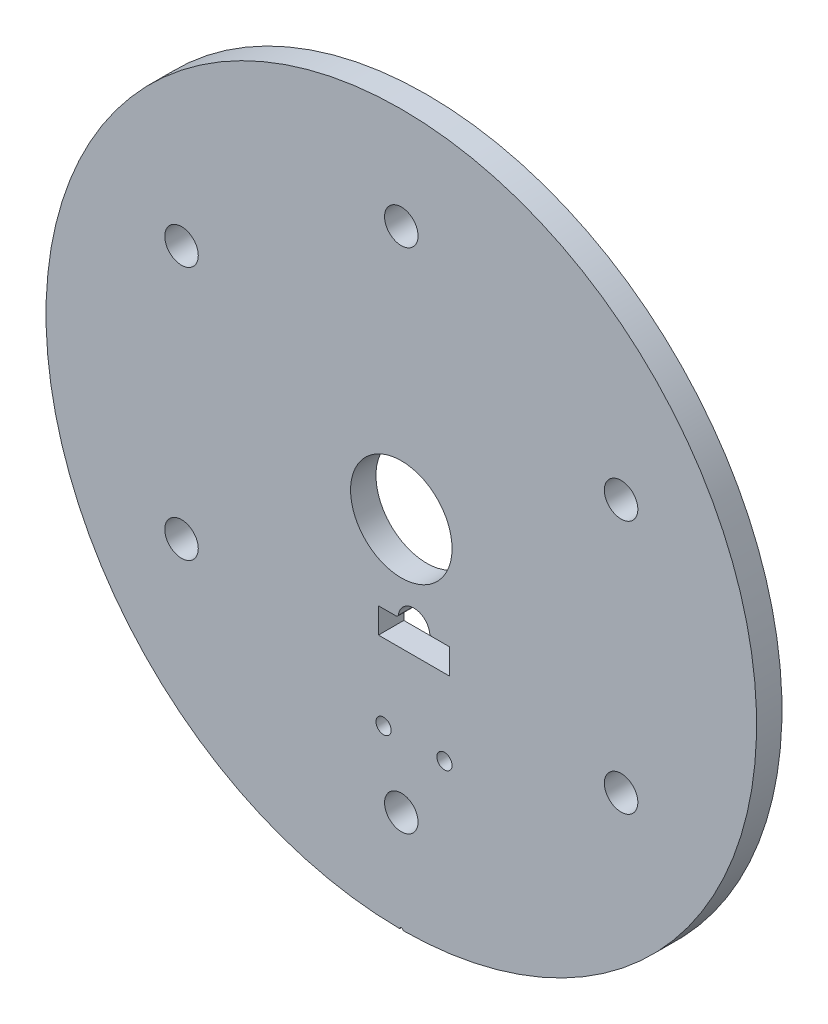
from build123d import *

# Parameters (mm, degrees)
SKETCH1_R                = 70
BOSS_EXTRUDE1_DEPTH      = 5
SKETCH4_R                = 3
CUT_EXTRUDE2_DEPTH       = 100.121138008
CIRPATTERN1_COUNT        = 6
M6_CLEARANCE_HOLE1_D     = 6.6
SKETCH7_W                = 14
SKETCH7_H                = 5
CUT_EXTRUDE3_DEPTH       = 100.121138008
SKETCH8_R                = 1
SKETCH8_R_2              = 3.1
CUT_EXTRUDE4_DEPTH       = 100.121138008
F_0000_CLEARANCE_HOLE3_D = 0.6604
FILLET1_R                = 0.5
SKETCH20_R               = 1.5
CUT_EXTRUDE6_DEPTH       = 100.121138008
SKETCH21_R               = 10
CUT_EXTRUDE9_DEPTH       = 100.121138008


with BuildPart() as part:
    # Sketch1 → Boss-Extrude1 (new body)
    with BuildSketch(Plane.XY):
        Circle(SKETCH1_R)
    extrude(amount=BOSS_EXTRUDE1_DEPTH)

    # Sketch4 → Cut-Extrude2 (cut, through all)
    with BuildSketch(Plane.XY):
        with Locations((0, 50)):
            Circle(SKETCH4_R)
    cut_extrude2 = extrude(amount=CUT_EXTRUDE2_DEPTH, mode=Mode.SUBTRACT)

    # CirPattern1: Cut-Extrude2 ×6 about axis
    cirpattern1_axis = Axis((0, 0, 46.505710968), (0, 0, -1))
    for i in range(1, CIRPATTERN1_COUNT):
        add(cut_extrude2.rotate(cirpattern1_axis, i * 360 / CIRPATTERN1_COUNT), mode=Mode.SUBTRACT)

    # M6 Clearance Hole1 (through all)
    with Locations(Plane.XY.offset(5)):
        with Locations((0, 50), (43.301270189, 25), (43.301270189, -25), (0, -50), (-43.301270189, -25), (-43.301270189, 25)):
            Hole(M6_CLEARANCE_HOLE1_D / 2)

    # Sketch7 → Cut-Extrude3 (cut, through all)
    with BuildSketch(Plane.XY):
        with Locations((2.5, -19.5)):
            Rectangle(SKETCH7_W, SKETCH7_H)
    extrude(amount=CUT_EXTRUDE3_DEPTH, mode=Mode.SUBTRACT)

    # Sketch8 → Cut-Extrude4 (cut, through all)
    with BuildSketch(Plane(origin=(0, 0, 0), x_dir=(-1, 0, 0), z_dir=(0, 0, -1))):
        with Locations((-2.5, 4)):
            Circle(SKETCH8_R)
        with Locations((-2.5, -17)):
            Circle(SKETCH8_R_2)
    extrude(amount=-CUT_EXTRUDE4_DEPTH, mode=Mode.SUBTRACT)

    # #0000 Clearance Hole3 (through all)
    with Locations(Plane(origin=(0, 0, 0), x_dir=(-1, 0, 0), z_dir=(0, 0, -1))):
        with Locations((-2.5, 4), (0, 0), (0, -70)):
            Hole(F_0000_CLEARANCE_HOLE3_D / 2)

    # Fillet1
    fillet1_edges = [part.edges().sort_by_distance(p)[0] for p in [
        (-0.6, -17, 2.5),
        (5.6, -17, 2.5),
    ]]
    fillet(fillet1_edges, radius=FILLET1_R)

    # Sketch20 → Cut-Extrude6 (cut, through all)
    with BuildSketch(Plane(origin=(0, 0, 0), x_dir=(-1, 0, 0), z_dir=(0, 0, -1))):
        with Locations((-8.5, -37)):
            Circle(SKETCH20_R)
        with Locations((3.5, -37)):
            Circle(SKETCH20_R)
    extrude(amount=-CUT_EXTRUDE6_DEPTH, mode=Mode.SUBTRACT)

    # Sketch21 → Cut-Extrude9 (cut, through all)
    with BuildSketch(Plane.XY):
        Circle(SKETCH21_R)
    extrude(amount=CUT_EXTRUDE9_DEPTH, mode=Mode.SUBTRACT)


solid = part.part
